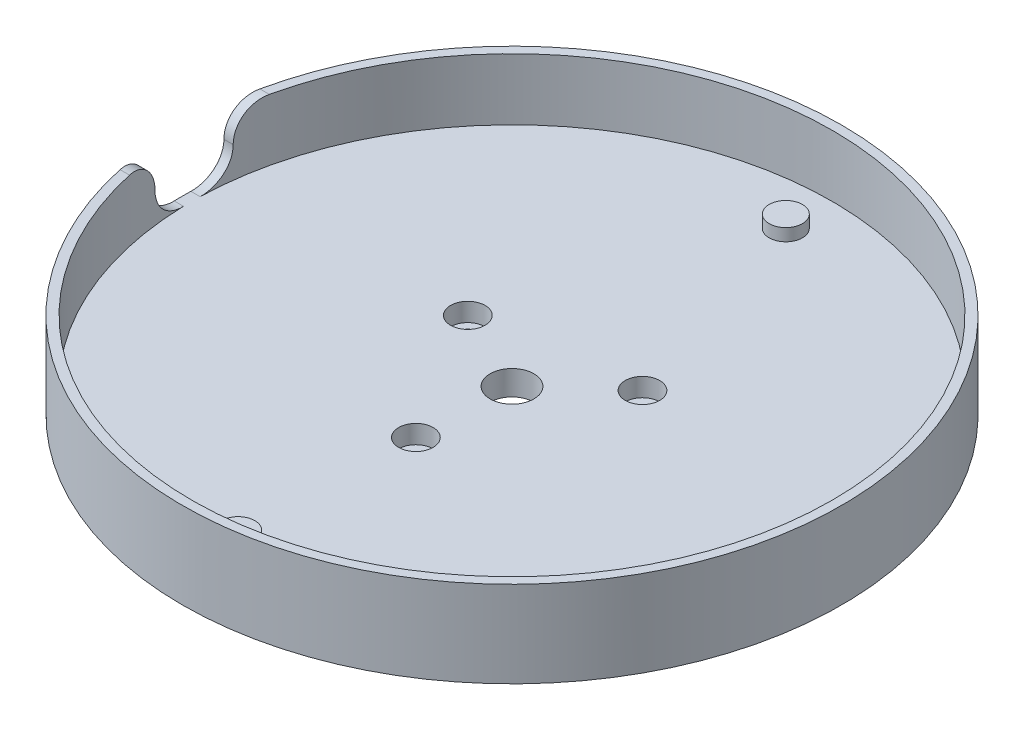
from build123d import *

# Parameters (mm, degrees)
SKETCH1_R           = 53.5
BOSS_EXTRUDE1_DEPTH = 2
SKETCH2_R           = 2.7
BOSS_EXTRUDE2_DEPTH = 2
SKETCH3_R           = 3.55
CUT_EXTRUDE1_DEPTH  = 2
SKETCH7_R           = 53.5
SKETCH7_R_2         = 52
BOSS_EXTRUDE3_DEPTH = 10
SKETCH8_W           = 56.651812746
SKETCH8_H           = 12.7
CUT_EXTRUDE4_DEPTH  = 10
SKETCH13_R          = 53.5
SKETCH13_R_2        = 3.55
BOSS_EXTRUDE4_DEPTH = 2
SKETCH12_R          = 2.8
CUT_EXTRUDE6_DEPTH  = 3
SKETCH16_R          = 1.5
CUT_EXTRUDE8_DEPTH  = 77.769134423
FILLET3_R           = 5


with BuildPart() as part:
    # Sketch1 → Boss-Extrude1 (new body)
    with BuildSketch(Plane(origin=(0, 0, 0), x_dir=(1, 0, 0), z_dir=(0, 1, 0))):
        with Locations(Location((0, 0, 0), (0, 0, 270))):
            Circle(SKETCH1_R)
    extrude(amount=BOSS_EXTRUDE1_DEPTH)

    # Sketch2 → Boss-Extrude2 (add)
    with BuildSketch(Plane(origin=(0, 2, 0), x_dir=(1, 0, 0), z_dir=(0, 1, 0))):
        with Locations(Location((0, -44.45, 0), (0, 0, 270))):
            Circle(SKETCH2_R)
        with Locations(Location((0, 44.45, 0), (0, 0, 270))):
            Circle(SKETCH2_R)
    extrude(amount=BOSS_EXTRUDE2_DEPTH)

    # Sketch3 → Cut-Extrude1 (cut)
    with BuildSketch(Plane(origin=(0, 2, 0), x_dir=(1, 0, 0), z_dir=(0, 1, 0))):
        with Locations(Location((0, 0, 0), (0, 0, 270))):
            Circle(SKETCH3_R)
    extrude(amount=-CUT_EXTRUDE1_DEPTH, mode=Mode.SUBTRACT)

    # Sketch7 → Boss-Extrude3 (add)
    with BuildSketch(Plane(origin=(0, 2, 0), x_dir=(1, 0, 0), z_dir=(0, 1, 0))):
        with Locations(Location((0, 0, 0), (0, 0, 270))):
            Circle(SKETCH7_R)
        with Locations(Location((0, 0, 0), (0, 0, 270))):
            Circle(SKETCH7_R_2, mode=Mode.SUBTRACT)
    extrude(amount=BOSS_EXTRUDE3_DEPTH)

    # Sketch8 → Cut-Extrude4 (cut)
    with BuildSketch(Plane(origin=(0, 2, 0), x_dir=(1, 0, 0), z_dir=(0, 1, 0))):
        with Locations((-28.325906373, 0)):
            Rectangle(SKETCH8_W, SKETCH8_H)
    extrude(amount=CUT_EXTRUDE4_DEPTH, mode=Mode.SUBTRACT)

    # Sketch13 → Boss-Extrude4 (add)
    with BuildSketch(Plane.XZ):
        with Locations(Location((0, 0, 0), (0, 0, 270))):
            Circle(SKETCH13_R)
        with Locations(Location((0, 0, 0), (0, 0, 90))):
            Circle(SKETCH13_R_2, mode=Mode.SUBTRACT)
    extrude(amount=BOSS_EXTRUDE4_DEPTH)

    # Sketch12 → Cut-Extrude6 (cut)
    with BuildSketch(Plane(origin=(0, 2, 0), x_dir=(1, 0, 0), z_dir=(0, 1, 0))):
        with Locations(Location((11.16900504, 10.012658309, 0), (0, 0, 270))):
            Circle(SKETCH12_R)
        with Locations(Location((-0.61610798, -14.987341691, 0), (0, 0, 270))):
            Circle(SKETCH12_R)
        with Locations(Location((-13.568010506, 6.396021491, 0), (0, 0, 270))):
            Circle(SKETCH12_R)
    extrude(amount=-CUT_EXTRUDE6_DEPTH, mode=Mode.SUBTRACT)

    # Sketch16 → Cut-Extrude8 (cut, through all)
    with BuildSketch(Plane(origin=(0, -1, 0), x_dir=(1, 0, 0), z_dir=(0, 1, 0))):
        with Locations(Location((11.16900504, 10.012658309, 0), (0, 0, 270))):
            Circle(SKETCH16_R)
        with Locations(Location((-0.61610798, -14.987341691, 0), (0, 0, 270))):
            Circle(SKETCH16_R)
        with Locations(Location((-13.568010506, 6.396021491, 0), (0, 0, 270))):
            Circle(SKETCH16_R)
    extrude(amount=-CUT_EXTRUDE8_DEPTH, mode=Mode.SUBTRACT)

    # Fillet3
    fillet3_edges = [part.edges().sort_by_distance(p)[0] for p in [
        (-52.366322452, 12, -6.35),
        (-52.366322452, 12, 6.35),
        (-52.366322452, 2, 6.35),
        (-52.366322452, 2, -6.35),
    ]]
    fillet(fillet3_edges, radius=FILLET3_R - 0.0001)  # a hair under: the kernel refuses the full size


solid = part.part
